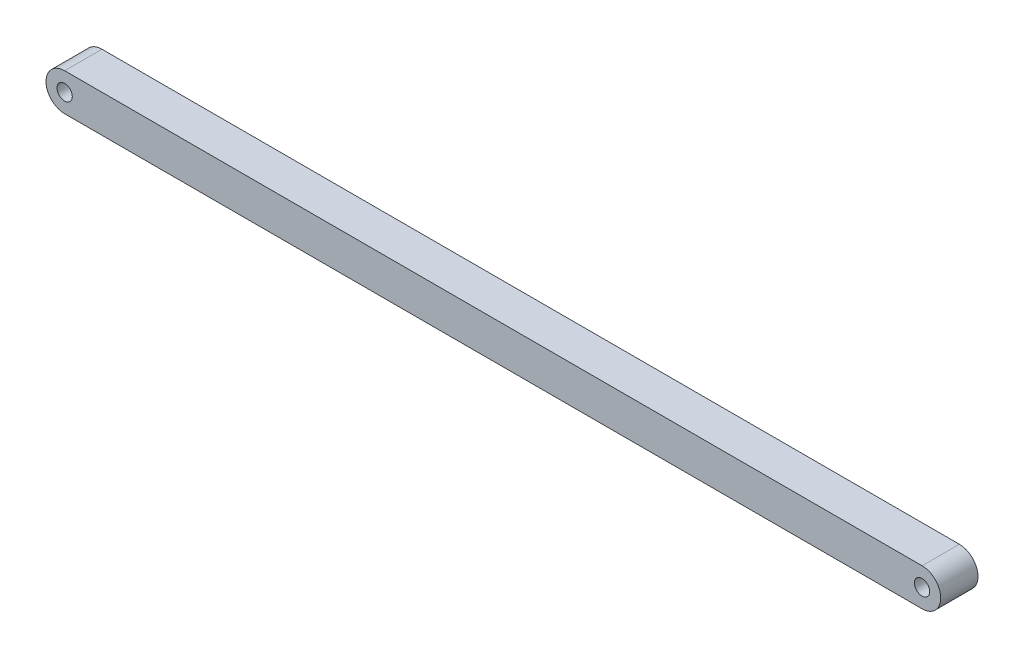
from build123d import *

# Parameters (mm, degrees)
AUFSATZ_LINEAR_AUSTRAGEN1_DEPTH      = 5
AUFSATZ_LINEAR_AUSTRAGEN1_DEPTH_BACK = 5
SKIZZE1_R                            = 2.05


with BuildPart() as part:
    # Skizze1 → Aufsatz-Linear austragen1 (new, two sides: drawn at the far end of the back side and taken through both)
    with BuildSketch(Plane.XY.offset(-AUFSATZ_LINEAR_AUSTRAGEN1_DEPTH_BACK)):
        with BuildLine():
            Line((115, 5), (-115, 5))
            ThreePointArc((-115, 5), (-120, 0), (-115, -5))
            Line((-115, -5), (115, -5))
            ThreePointArc((115, -5), (120, 0), (115, 5))
        make_face()
        with Locations((-115, 0)):
            Circle(SKIZZE1_R, mode=Mode.SUBTRACT)
        with Locations((115, 0)):
            Circle(SKIZZE1_R, mode=Mode.SUBTRACT)
    extrude(amount=AUFSATZ_LINEAR_AUSTRAGEN1_DEPTH + AUFSATZ_LINEAR_AUSTRAGEN1_DEPTH_BACK)


solid = part.part
